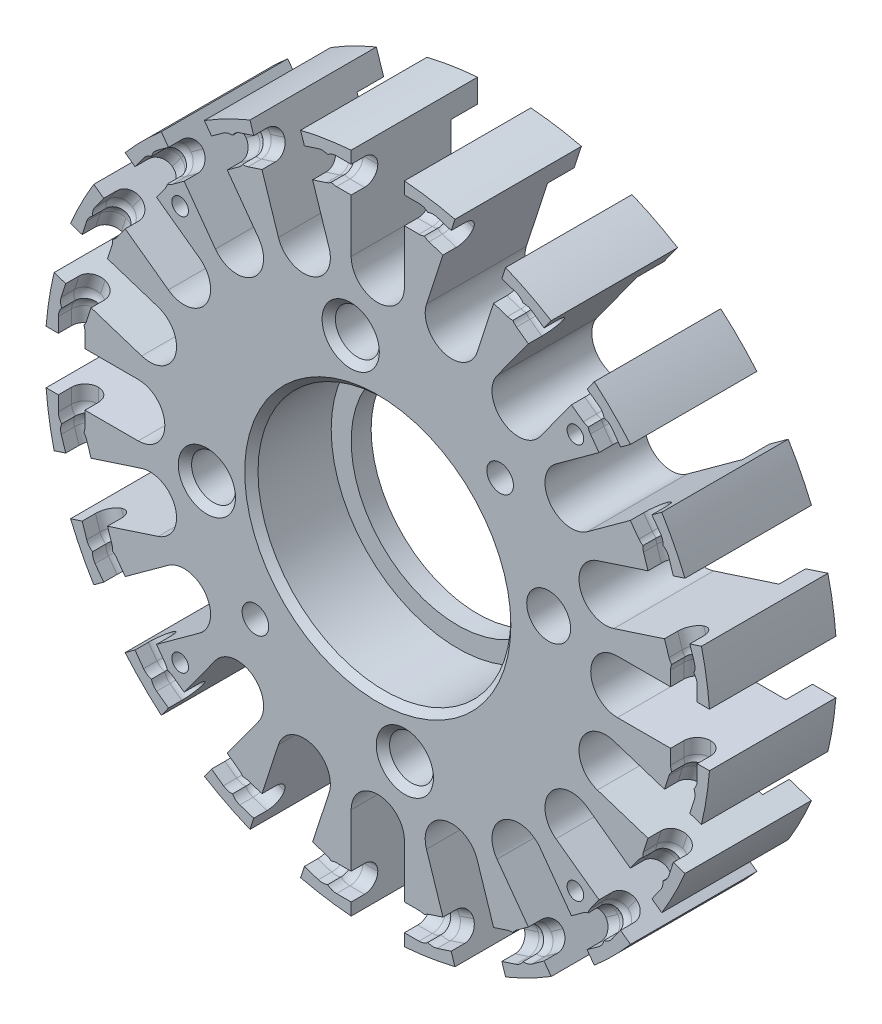
from build123d import *

# Parameters (mm, degrees)
SKETCH_1_R                = 25
EXTRUDE_1_DEPTH           = 9.5
SKETCH_10_R               = 8
CUT_EXTRUDE_7_DEPTH       = 9.5
SKETCH_6_R                = 23.25
CUT_EXTRUDE_6_DEPTH       = 2
SKETCH_2_R                = 9.5
CUT_EXTRUDE_2_DEPTH       = 6
SKETCH_3_R                = 1.65
CUT_EXTRUDE_3_DEPTH       = 10
PATTERN_CIRCULAR_1_COUNT  = 4
CUT_EXTRUDE_START         = -10
CUT_EXTRUDE_5_DEPTH       = 10
PATTERN_CIRCULAR_3_COUNT  = 20
CHAMFER_1_SIZE            = 0.5
SKETCH_19_R               = 1
CUT_EXTRUDE_1_DEPTH       = 4.5
HOLE_WIZARD_M1_6_3_D      = 1.25
PATTERN_CIRCULAR_5_COUNT  = 4
CHAMFER_3_SIZE            = 0.25
CHAMFER_3_SIZE2           = 0.066987298
SKETCH_38_W               = 6.2
SKETCH_38_H               = 2
CUT_EXTRUDE_7_2_DEPTH     = 2
FILLET_17_R               = 1
CUT_EXTRUDE_11_DEPTH      = 1
CUT_REVOLVE_4_ANGLE       = 90
PATTERN_CIRCULAR_12_COUNT = 20
FILLET_18_R               = 1
PATTERN_CIRCULAR_14_COUNT = 20
CUT_EXTRUDE_12_DEPTH      = 1
FILLET_19_R               = 1
CUT_REVOLVE_5_ANGLE       = 90
PATTERN_CIRCULAR_15_COUNT = 20
PATTERN_CIRCULAR_16_COUNT = 20
FILLET_20_R               = 1


with BuildPart() as part:
    # 草图1 → 拉伸1 (new body)
    with BuildSketch(Plane.XY):
        Circle(SKETCH_1_R)
    extrude(amount=EXTRUDE_1_DEPTH)

    # 草图10 → Cut-Extrude 7 (cut)
    with BuildSketch(Plane.XY.offset(9.5)):
        Circle(SKETCH_10_R)
    extrude(amount=-CUT_EXTRUDE_7_DEPTH, mode=Mode.SUBTRACT)

    # 草图6 → 拉伸6 (cut)
    with BuildSketch(Plane(origin=(0, 0, 0), x_dir=(-1, 0, 0), z_dir=(0, 0, -1))):
        Circle(SKETCH_6_R)
    extrude(amount=-CUT_EXTRUDE_6_DEPTH, mode=Mode.SUBTRACT)

    # 草图2 → 拉伸2 (cut)
    with BuildSketch(Plane.XY.offset(9.5)):
        Circle(SKETCH_2_R)
    extrude(amount=-CUT_EXTRUDE_2_DEPTH, mode=Mode.SUBTRACT)

    # 草图3 → 拉伸3 (cut)
    with BuildSketch(Plane.XY.offset(9.5)):
        with Locations((-2.033648046, 12.839948428)):
            Circle(SKETCH_3_R)
    cut_extrude_3 = extrude(amount=-CUT_EXTRUDE_3_DEPTH, mode=Mode.SUBTRACT)

    # 阵列(圆周)1: 拉伸3 ×4 about axis
    pattern_circular_1_axis = Axis((0, 0, 0), (0, 0, 1))
    for i in range(1, PATTERN_CIRCULAR_1_COUNT):
        add(cut_extrude_3.rotate(pattern_circular_1_axis, i * 360 / PATTERN_CIRCULAR_1_COUNT), mode=Mode.SUBTRACT)

    # 草图5 → 拉伸5 (cut)
    with BuildSketch(Plane.XY.offset(9.5).offset(CUT_EXTRUDE_START)):
        with BuildLine():
            Line((-18, 2), (-24.919871589, 2))
            ThreePointArc((-24.919871589, 2), (-25, 0), (-24.919871589, -2))
            Line((-24.919871589, -2), (-18, -2))
            ThreePointArc((-18, -2), (-16, 0), (-18, 2))
        make_face()
    cut_extrude_5 = extrude(amount=CUT_EXTRUDE_5_DEPTH, mode=Mode.SUBTRACT)

    # 阵列(圆周)3: 拉伸5 ×20 about axis
    pattern_circular_3_axis = Axis((0, 0, 0), (0, 0, 1))
    for i in range(1, PATTERN_CIRCULAR_3_COUNT):
        add(cut_extrude_5.rotate(pattern_circular_3_axis, i * 360 / PATTERN_CIRCULAR_3_COUNT), mode=Mode.SUBTRACT)

    # 倒角1
    chamfer_1_edges = [part.edges().sort_by_distance(p)[0] for p in [
        (-9.5, 0, 9.5),
        (-3.683648046, 12.839948428, 9.5),
        (-12.839948428, -3.683648046, 9.5),
        (3.683648046, -12.839948428, 9.5),
    ]]
    chamfer(chamfer_1_edges, length=CHAMFER_1_SIZE)

    # 草图19 → 切除-拉伸1 (cut)
    with BuildSketch(Plane.XY.offset(9.5)):
        with Locations((9.192388155, 9.192388155)):
            Circle(SKETCH_19_R)
        with Locations((-9.192388155, -9.192388155)):
            Circle(SKETCH_19_R)
    extrude(amount=-CUT_EXTRUDE_1_DEPTH, mode=Mode.SUBTRACT)

    # M1.6 螺纹孔3 (through all)
    with Locations(Plane(origin=(0, 0, 2), x_dir=(-1, 0, 0), z_dir=(0, 0, -1))):
        with Locations((14.849242405, 14.849242405)):
            hole_wizard_m1_6_3 = Hole(HOLE_WIZARD_M1_6_3_D / 2)

    # 阵列(圆周)5: M1.6 螺纹孔3 ×4 about axis
    pattern_circular_5_axis = Axis((0, 0, 0), (0, 0, 1))
    for i in range(1, PATTERN_CIRCULAR_5_COUNT):
        add(hole_wizard_m1_6_3.rotate(pattern_circular_5_axis, i * 360 / PATTERN_CIRCULAR_5_COUNT), mode=Mode.SUBTRACT)

    # 倒角3
    chamfer_3_edges = [part.edges().sort_by_distance(p)[0] for p in [
        (-15.474242405, 14.849242405, 2),
        (-14.849242405, -15.474242405, 2),
        (15.474242405, -14.849242405, 2),
        (14.849242405, 15.474242405, 2),
    ]]
    chamfer_3_side = [part.faces().sort_by_distance(p)[0] for p in [
        (-15.344828267, 0, 2),
    ]]
    chamfer(chamfer_3_edges, length=CHAMFER_3_SIZE, length2=CHAMFER_3_SIZE2, reference=chamfer_3_side[0])

    # 草图38 → Cut-Extrude 7 2 (cut)
    with BuildSketch(Plane.XY.offset(9.5)):
        with Locations((0, 23)):
            Rectangle(SKETCH_38_W, SKETCH_38_H)
    cut_extrude_7_2 = extrude(amount=-CUT_EXTRUDE_7_2_DEPTH, mode=Mode.SUBTRACT)

    # 圆角17
    fillet_17_edges = [part.edges().sort_by_distance(p)[0] for p in [
        (-2.55, 22, 7.5),
        (-2.55, 24, 7.5),
    ]]
    fillet(fillet_17_edges, radius=FILLET_17_R - 0.0001)  # a hair under: the kernel refuses the full size

    # 草图38<14> → 切除-拉伸11 (cut)
    with BuildSketch(Plane.XY.offset(9.5)):
        with BuildLine():
            Line((-3.1, 24), (-3.1, 22))
            ThreePointArc((-3.1, 22), (-4.1, 23), (-3.1, 24))
        make_face()
    cut_extrude_11 = extrude(amount=-CUT_EXTRUDE_11_DEPTH, mode=Mode.SUBTRACT)

    # 草图46 → 切除-旋转4 (revolve, cut)
    with BuildSketch(Plane(origin=(-3.1, 0, 0), x_dir=(0, 0, -1), z_dir=(1, 0, 0))):
        with BuildLine():
            Line((-8.5, 22), (-8.5, 24))
            ThreePointArc((-8.5, 24), (-7.5, 23), (-8.5, 22))
        make_face()
    cut_revolve_4 = revolve(axis=Axis((-3.1, 22, 8.5), (0, 1, 0)), revolution_arc=CUT_REVOLVE_4_ANGLE, mode=Mode.SUBTRACT)

    # 阵列(圆周)12: 切除-拉伸11, 切除-旋转4 ×20 about axis
    pattern_circular_12_axis = Axis((0, 0, 0), (0, 0, 1))
    add([cut_extrude_11.rotate(pattern_circular_12_axis, i * 360 / PATTERN_CIRCULAR_12_COUNT) for i in range(1, PATTERN_CIRCULAR_12_COUNT)], mode=Mode.SUBTRACT)
    add([cut_revolve_4.rotate(pattern_circular_12_axis, i * 360 / PATTERN_CIRCULAR_12_COUNT) for i in range(1, PATTERN_CIRCULAR_12_COUNT)], mode=Mode.SUBTRACT)

    # 圆角18
    fillet_18_edges = [part.edges().sort_by_distance(p)[0] for p in [
        (2.55, 22, 7.5),
        (2.55, 24, 7.5),
    ]]
    fillet(fillet_18_edges, radius=FILLET_18_R - 0.0001)  # a hair under: the kernel refuses the full size

    # 阵列(圆周)14: Cut-Extrude 7 2 ×20 about axis
    pattern_circular_14_axis = Axis((0, 0, 0), (0, 0, 1))
    for i in range(1, PATTERN_CIRCULAR_14_COUNT):
        add(cut_extrude_7_2.rotate(pattern_circular_14_axis, i * 360 / PATTERN_CIRCULAR_14_COUNT), mode=Mode.SUBTRACT)

    # 草图38<15> → 切除-拉伸12 (cut)
    with BuildSketch(Plane.XY.offset(9.5)):
        with BuildLine():
            Line((3.1, 24), (3.1, 22))
            ThreePointArc((3.1, 22), (4.1, 23), (3.1, 24))
        make_face()
    cut_extrude_12 = extrude(amount=-CUT_EXTRUDE_12_DEPTH, mode=Mode.SUBTRACT)

    # 圆角19
    fillet_19_edges = [part.edges().sort_by_distance(p)[0] for p in [
        (-20.135250023, 9.223567993, 7.5),
        (-22.037363055, 9.841601982, 7.5),
        (-19.29722627, 10.868282215, 7.5),
        (-20.915260258, 12.043852719, 7.5),
        (-16.299521483, 14.994268886, 7.5),
        (-17.917555472, 16.169839391, 7.5),
        (-14.994268886, 16.299521483, 7.5),
        (-16.169839391, 17.917555472, 7.5),
        (-10.868282215, 19.29722627, 7.5),
        (-12.043852719, 20.915260258, 7.5),
        (-9.223567993, 20.135250023, 7.5),
        (-9.841601982, 22.037363055, 7.5),
        (-4.37317976, 21.711236694, 7.5),
        (-4.991213748, 23.613349727, 7.5),
    ]]
    fillet(fillet_19_edges, radius=FILLET_19_R - 0.0001)  # a hair under: the kernel refuses the full size

    # 草图47 → 切除-旋转5 (revolve, cut)
    with BuildSketch(Plane.ZY.offset(-3.1)):
        with BuildLine():
            Line((8.5, 24), (8.5, 22))
            ThreePointArc((8.5, 22), (7.5, 23), (8.5, 24))
        make_face()
    cut_revolve_5 = revolve(axis=Axis((3.1, 24, 8.5), (0, -1, 0)), revolution_arc=CUT_REVOLVE_5_ANGLE, mode=Mode.SUBTRACT)

    # 阵列(圆周)15: 切除-旋转5 ×20 about axis
    pattern_circular_15_axis = Axis((0, 0, 0), (0, 0, 1))
    for i in range(1, PATTERN_CIRCULAR_15_COUNT):
        add(cut_revolve_5.rotate(pattern_circular_15_axis, i * 360 / PATTERN_CIRCULAR_15_COUNT), mode=Mode.SUBTRACT)

    # 阵列(圆周)16: 切除-拉伸12 ×20 about axis
    pattern_circular_16_axis = Axis((0, 0, 0), (0, 0, 1))
    for i in range(1, PATTERN_CIRCULAR_16_COUNT):
        add(cut_extrude_12.rotate(pattern_circular_16_axis, i * 360 / PATTERN_CIRCULAR_16_COUNT), mode=Mode.SUBTRACT)

    # 圆角20
    fillet_20_edges = [part.edges().sort_by_distance(p)[0] for p in [
        (-21.711236694, 4.37317976, 7.5),
        (-23.613349727, 4.991213748, 7.5),
        (4.37317976, 21.711236694, 7.5),
        (4.991213748, 23.613349727, 7.5),
        (9.223567993, 20.135250023, 7.5),
        (9.841601982, 22.037363055, 7.5),
        (10.868282215, 19.29722627, 7.5),
        (12.043852719, 20.915260258, 7.5),
        (16.169839391, 17.917555472, 7.5),
        (14.994268886, 16.299521483, 7.5),
        (17.917555472, 16.169839391, 7.5),
        (16.299521483, 14.994268886, 7.5),
        (19.29722627, 10.868282215, 7.5),
        (20.915260258, 12.043852719, 7.5),
        (22.037363055, 9.841601982, 7.5),
        (20.135250023, 9.223567993, 7.5),
        (23.613349727, 4.991213748, 7.5),
        (21.711236694, 4.37317976, 7.5),
        (24, 2.55, 7.5),
        (22, 2.55, 7.5),
        (24, -2.55, 7.5),
        (22, -2.55, 7.5),
        (23.613349727, -4.991213748, 7.5),
        (21.711236694, -4.37317976, 7.5),
        (22.037363055, -9.841601982, 7.5),
        (20.135250023, -9.223567993, 7.5),
        (19.29722627, -10.868282215, 7.5),
        (20.915260258, -12.043852719, 7.5),
        (16.299521483, -14.994268886, 7.5),
        (17.917555472, -16.169839391, 7.5),
        (14.994268886, -16.299521483, 7.5),
        (16.169839391, -17.917555472, 7.5),
        (10.868282215, -19.29722627, 7.5),
        (12.043852719, -20.915260258, 7.5),
        (9.223567993, -20.135250023, 7.5),
        (9.841601982, -22.037363055, 7.5),
        (4.37317976, -21.711236694, 7.5),
        (4.991213748, -23.613349727, 7.5),
        (2.55, -22, 7.5),
        (2.55, -24, 7.5),
        (-2.55, -22, 7.5),
        (-2.55, -24, 7.5),
        (-4.37317976, -21.711236694, 7.5),
        (-4.991213748, -23.613349727, 7.5),
        (-9.223567993, -20.135250023, 7.5),
        (-9.841601982, -22.037363055, 7.5),
        (-10.868282215, -19.29722627, 7.5),
        (-12.043852719, -20.915260258, 7.5),
        (-14.994268886, -16.299521483, 7.5),
        (-16.169839391, -17.917555472, 7.5),
        (-16.299521483, -14.994268886, 7.5),
        (-17.917555472, -16.169839391, 7.5),
        (-19.29722627, -10.868282215, 7.5),
        (-20.915260258, -12.043852719, 7.5),
        (-20.135250023, -9.223567993, 7.5),
        (-22.037363055, -9.841601982, 7.5),
        (-21.711236694, -4.37317976, 7.5),
        (-23.613349727, -4.991213748, 7.5),
        (-22, -2.55, 7.5),
        (-24, -2.55, 7.5),
        (-22, 2.55, 7.5),
        (-24, 2.55, 7.5),
    ]]
    fillet(fillet_20_edges, radius=FILLET_20_R - 0.0001)  # a hair under: the kernel refuses the full size


solid = part.part
